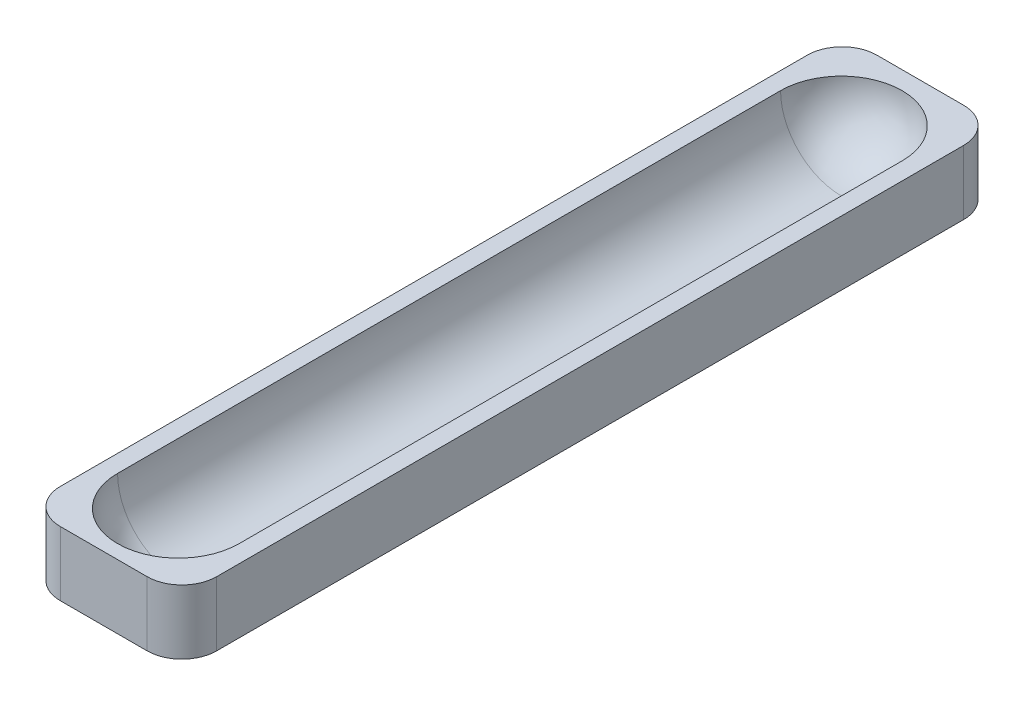
from build123d import *

# Parameters (mm, degrees)
SKETCH1_W           = 114.3
SKETCH1_H           = 596.9
BOSS_EXTRUDE1_DEPTH = 46.99
CUT_REVOLVE1_ANGLE  = 180
FILLET1_R           = 25.4


with BuildPart() as part:
    # Sketch1 → Boss-Extrude1 (new body)
    with BuildSketch(Plane(origin=(0, 0, 0), x_dir=(1, 0, 0), z_dir=(0, 1, 0))):
        with Locations((-57.15, 298.45)):
            Rectangle(SKETCH1_W, SKETCH1_H)
    extrude(amount=BOSS_EXTRUDE1_DEPTH)

    # Sketch2 → Cut-Revolve1 (revolve, cut)
    with BuildSketch(Plane(origin=(0, 46.99, 0), x_dir=(1, 0, 0), z_dir=(0, 1, 0))):
        with BuildLine():
            ThreePointArc((-12.7, 539.208766564), (-25.719103576, 570.639662987), (-57.15, 583.658766564))
            Line((-57.15, 583.658766564), (-57.15, 10.109470377))
            ThreePointArc((-57.15, 10.109470377), (-25.719103576, 23.128573953), (-12.7, 54.559470377))
            Line((-12.7, 54.559470377), (-12.7, 539.208766564))
        make_face()
    revolve(axis=Axis((-57.15, 46.99, -596.9), (0, 0, -1)), revolution_arc=CUT_REVOLVE1_ANGLE, mode=Mode.SUBTRACT)

    # Fillet1
    fillet1_edges = [part.edges().sort_by_distance(p)[0] for p in [
        (0, 23.495, 0),
        (-114.3, 23.495, 0),
        (-114.3, 23.495, -596.9),
        (0, 23.495, -596.9),
    ]]
    fillet(fillet1_edges, radius=FILLET1_R)


solid = part.part
